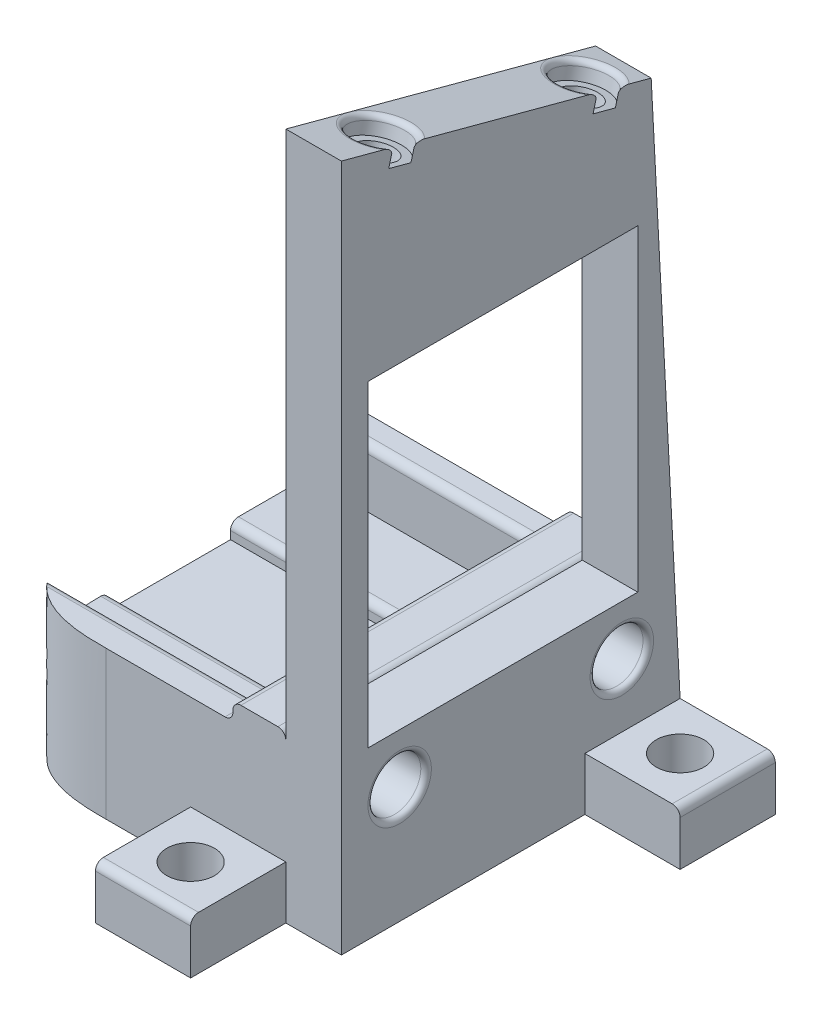
from build123d import *

# Parameters (mm, degrees)
BOSS_EXTRUDE1_DEPTH = 11
SKETCH3_W           = 22
SKETCH3_H           = 3
BOSS_EXTRUDE2_DEPTH = 14
BOSS_EXTRUDE3_DEPTH = 5
SKETCH5_R           = 1.75
CUT_EXTRUDE1_DEPTH  = 36.096650541
SKETCH6_W           = 9
SKETCH6_H           = 9
BOSS_EXTRUDE4_DEPTH = 5
SKETCH10_R          = 2.25
CUT_EXTRUDE2_DEPTH  = 34.584744739
FILLET1_R           = 0.75
FILLET2_SIZE        = 10
SKETCH12_W          = 9
SKETCH12_H          = 32.0178
BOSS_EXTRUDE5_DEPTH = 65
CUT_EXTRUDE4_DEPTH  = 9
SKETCH14_R          = 2.5
CUT_EXTRUDE5_DEPTH  = 9.75
SKETCH15_R          = 1.7
CUT_EXTRUDE6_DEPTH  = 5
SKETCH16_R          = 2.5
CUT_EXTRUDE7_DEPTH  = 1.6
FILLET3_R           = 0.5
FILLET4_R           = 0.5
SKETCH17_W          = 3.75
SKETCH17_H          = 32.0178
CUT_EXTRUDE9_DEPTH  = 74.996250596
SKETCH18_W          = 9
SKETCH18_H          = 9
BOSS_EXTRUDE6_DEPTH = 5
CUT_EXTRUDE10_REACH = 73.697
SKETCH19_R          = 2.25
FILLET6_START       = -17
FILLET6_DEPTH       = 11
CUT_EXTRUDE11_REACH = 76.696
SKETCH20_W          = 25.5
SKETCH20_H          = 30
CUT_EXTRUDE12_DEPTH = 77.749642368


with BuildPart() as part:
    # Sketch1 → Boss-Extrude1 (new, symmetric)
    with BuildSketch(Plane(origin=(0, 0, 0), x_dir=(0, 0, -1), z_dir=(1, 0, 0))):
        Polygon((-13.0089, 0), (13.0089, 0), (13.0089, 8.5), (5.7589, 8.5), (5.7589, 7), (-5.7589, 7), (-5.7589, 8.5), (-13.0089, 8.5), align=None)
    extrude(amount=BOSS_EXTRUDE1_DEPTH, both=True)

    # Sketch3 → Boss-Extrude2 (add)
    with BuildSketch(Plane.XZ):
        with Locations((0, -14.5089)):
            Rectangle(SKETCH3_W, SKETCH3_H)
        with Locations((0, 14.5089)):
            Rectangle(SKETCH3_W, SKETCH3_H)
    extrude(amount=-BOSS_EXTRUDE2_DEPTH)

    # Sketch4 → Boss-Extrude3 (add)
    with BuildSketch(Plane(origin=(11, 0, 0), x_dir=(0, 0, -1), z_dir=(1, 0, 0))):
        Polygon((-8.8, 15.7), (-16.0089, 15.7), (-16.0089, 0), (16.0089, 0), (16.0089, 15.7), align=None)
    extrude(amount=BOSS_EXTRUDE3_DEPTH)

    # Sketch5 → Cut-Extrude1 (cut, through all)
    with BuildSketch(Plane(origin=(16, 0, 0), x_dir=(0, 0, -1), z_dir=(1, 0, 0))):
        with Locations((-10.5, 11)):
            Circle(SKETCH5_R)
        with Locations((10.5, 11)):
            Circle(SKETCH5_R)
    extrude(amount=-CUT_EXTRUDE1_DEPTH, mode=Mode.SUBTRACT)

    # Sketch6 → Boss-Extrude4 (add)
    with BuildSketch(Plane.XZ):
        with Locations((11.5, 20.5089)):
            Rectangle(SKETCH6_W, SKETCH6_H)
    extrude(amount=-BOSS_EXTRUDE4_DEPTH)

    # Sketch10 → Cut-Extrude2 (cut, through all)
    with BuildSketch(Plane.XZ):
        with Locations(Location((11.5, 20.5089, 0), (0, 0, 270))):
            Circle(SKETCH10_R)
    extrude(amount=-CUT_EXTRUDE2_DEPTH, mode=Mode.SUBTRACT)

    # Fillet1
    fillet1_edges = [part.edges().sort_by_distance(p)[0] for p in [
        (0, 8.5, 5.7589),
        (0, 8.5, -5.7589),
        (0, 14, -13.0089),
        (11, 14, -14.5089),
        (11, 11.25, -13.0089),
        (11, 14, 14.5089),
        (11, 11.25, 13.0089),
        (0, 14, 13.0089),
        (11, 15.7, 0),
        (16, 15.7, 0),
        (11.5, 5, 25.0089),
    ]]
    fillet(fillet1_edges, radius=FILLET1_R)

    # Fillet2
    # a fillet whose section is not a circle: 10 mm, written as the material it takes off along each edge
    with BuildSketch(Plane(origin=(-11, -25, 16.0089), x_dir=(0, 0, -1), z_dir=(0, 1, 0))) as fillet2_piece_1:
        with BuildLine():
            add(Edge.make_bspline([(FILLET2_SIZE, 0), (FILLET2_SIZE * 0.831801948466, 0), (FILLET2_SIZE * 0.663603896932, 0), (FILLET2_SIZE * 0.292893218813, -FILLET2_SIZE * 0.0716919198361), (FILLET2_SIZE * 0.0716919198361, -FILLET2_SIZE * 0.292893218813), (0, -FILLET2_SIZE * 0.663603896932), (0, -FILLET2_SIZE * 0.831801948466), (0, -FILLET2_SIZE)], knots=[0, 0, 0, 0, 0, 0, 0.5, 0.5, 1, 1, 1, 1, 1, 1], degree=5))
            Line((0, -FILLET2_SIZE), (0, 0))
            Line((0, 0), (FILLET2_SIZE, 0))
        make_face()
    extrude(amount=64, mode=Mode.SUBTRACT)

    # Sketch12 → Boss-Extrude5 (add)
    with BuildSketch(Plane.XZ):
        with Locations((20.5, 0)):
            Rectangle(SKETCH12_W, SKETCH12_H)
    extrude(amount=-BOSS_EXTRUDE5_DEPTH)

    # Sketch13 → Cut-Extrude4 (cut)
    with BuildSketch(Plane(origin=(25, 0, 0), x_dir=(0, 0, -1), z_dir=(1, 0, 0))):
        Polygon((16.0089, 65), (-16.0089, 65), (16.0089, 56.420856347), align=None)
    extrude(amount=-CUT_EXTRUDE4_DEPTH, mode=Mode.SUBTRACT)

    # Sketch14 → Cut-Extrude5 (cut)
    with BuildSketch(Plane(origin=(25, 0, 0), x_dir=(0, 0, -1), z_dir=(1, 0, 0))):
        with Locations((-10.5, 11)):
            Circle(SKETCH14_R)
        with Locations((10.5, 11)):
            Circle(SKETCH14_R)
    extrude(amount=-CUT_EXTRUDE5_DEPTH, mode=Mode.SUBTRACT)

    # Sketch15 → Cut-Extrude6 (cut)
    with BuildSketch(Plane(origin=(0, 56.643600623, -15.177607043), x_dir=(1, 0, 0), z_dir=(0, 0.9659258262890701, -0.25881904510251424))):
        with Locations(Location((19, -6.139382203, 0), (0, 0, 270))):
            Circle(SKETCH15_R)
        with Locations(Location((19, -26.139382203, 0), (0, 0, 270))):
            Circle(SKETCH15_R)
    extrude(amount=-CUT_EXTRUDE6_DEPTH, mode=Mode.SUBTRACT)

    # Sketch16 → Cut-Extrude7 (cut)
    with BuildSketch(Plane(origin=(0, 56.643600623, -15.177607043), x_dir=(1, 0, 0), z_dir=(0, 0.9659258262890701, -0.25881904510251424))):
        with Locations(Location((19, -6.139382203, 0), (0, 0, 270))):
            Circle(SKETCH16_R)
        with Locations(Location((19, -26.139382203, 0), (0, 0, 270))):
            Circle(SKETCH16_R)
    extrude(amount=-CUT_EXTRUDE7_DEPTH, mode=Mode.SUBTRACT)

    # Fillet3
    fillet3_edges = [part.edges().sort_by_distance(p)[0] for p in [
        (19, 57.58554205, -11.662233782),
        (19, 62.761922952, 7.656282744),
    ]]
    fillet(fillet3_edges, radius=FILLET3_R)

    # Fillet4
    fillet4_edges = [part.edges().sort_by_distance(p)[0] for p in [
        (25, 11, 13),
        (25, 11, -8),
    ]]
    fillet(fillet4_edges, radius=FILLET4_R)

    # Sketch17 → Cut-Extrude9 (cut, through all)
    with BuildSketch(Plane(origin=(0, 65, 0), x_dir=(-1, 0, 0), z_dir=(0, -1, 0))):
        with Locations((-23.125, 0)):
            Rectangle(SKETCH17_W, SKETCH17_H)
    extrude(amount=CUT_EXTRUDE9_DEPTH, mode=Mode.SUBTRACT)

    # Fillet5: read off the stored shape, not the designer's step
    # Fillet5 outline → Fillet5 (revolve, cut)
    with BuildSketch(Plane(origin=(0, 11, -10.5), x_dir=(0, 1, 0), z_dir=(0, 0, -1))):
        with BuildLine():
            ThreePointArc((2.5, 20.75), (2.646446609, 21.103553391), (3, 21.25))
            Line((3, 21.25), (2.5, 21.25))
            Line((2.5, 21.25), (2.5, 20.75))
        make_face()
    revolve(axis=Axis((0, 11, -10.5), (1, 0, 0)), mode=Mode.SUBTRACT)

    # Fillet5 2 outline → Fillet5 2 (revolve, cut)
    with BuildSketch(Plane(origin=(0, 11, 10.5), x_dir=(0, 1, 0), z_dir=(0, 0, -1))):
        with BuildLine():
            ThreePointArc((2.5, 20.75), (2.646446609, 21.103553391), (3, 21.25))
            Line((3, 21.25), (2.5, 21.25))
            Line((2.5, 21.25), (2.5, 20.75))
        make_face()
    revolve(axis=Axis((0, 11, 10.5), (1, 0, 0)), mode=Mode.SUBTRACT)

    # Sketch18 → Boss-Extrude6 (add)
    with BuildSketch(Plane.XZ):
        with Locations((25.75, -11.5089)):
            Rectangle(SKETCH18_W, SKETCH18_H)
    extrude(amount=-BOSS_EXTRUDE6_DEPTH)

    # Sketch19 → Cut-Extrude10 (cut, up to next)
    with BuildSketch(Plane(origin=(0, 5, 0), x_dir=(1, 0, 0), z_dir=(0, 1, 0)), mode=Mode.PRIVATE) as cut_extrude10_sk1:
        with Locations(Location((25.75, 11.5089, 0), (0, 0, 270))):
            Circle(SKETCH19_R)
    cut_extrude10_tool1 = extrude(cut_extrude10_sk1.sketch, amount=-CUT_EXTRUDE10_REACH, mode=Mode.PRIVATE) & part.part
    add(cut_extrude10_tool1.solids().sort_by_distance((25.75, 5, -11.5089))[0], mode=Mode.SUBTRACT)

    # Fillet6: read off the stored shape, not the designer's step
    # Fillet6 outline → Fillet6 (cut)
    with BuildSketch(Plane.XY.offset(FILLET6_START)):
        with BuildLine():
            ThreePointArc((29.5, 5), (30.030330086, 4.780330086), (30.25, 4.25))
            Line((30.25, 4.25), (30.25, 5))
            Line((30.25, 5), (29.5, 5))
        make_face()
    extrude(amount=FILLET6_DEPTH, mode=Mode.SUBTRACT)

    # Sketch20 → Cut-Extrude11 (cut, up to next)
    with BuildSketch(Plane.ZY.offset(-16), mode=Mode.PRIVATE) as cut_extrude11_sk1:
        with Locations((0.7411, 30.7)):
            Rectangle(SKETCH20_W, SKETCH20_H)
    cut_extrude11_tool1 = extrude(cut_extrude11_sk1.sketch, amount=-CUT_EXTRUDE11_REACH, mode=Mode.PRIVATE) & part.part
    add(cut_extrude11_tool1.solids().sort_by_distance((16, 30.7, 0.7411))[0], mode=Mode.SUBTRACT)

    # Sketch21 → Cut-Extrude12 (cut, through all)
    with BuildSketch(Plane(origin=(21.25, 0, 0), x_dir=(0, 0, -1), z_dir=(1, 0, 0))):
        Polygon((16.0089, 5), (16.0089, 56.420856347), (13.275665328, 57.15322437), align=None)
    extrude(amount=-CUT_EXTRUDE12_DEPTH, mode=Mode.SUBTRACT)


solid = part.part
